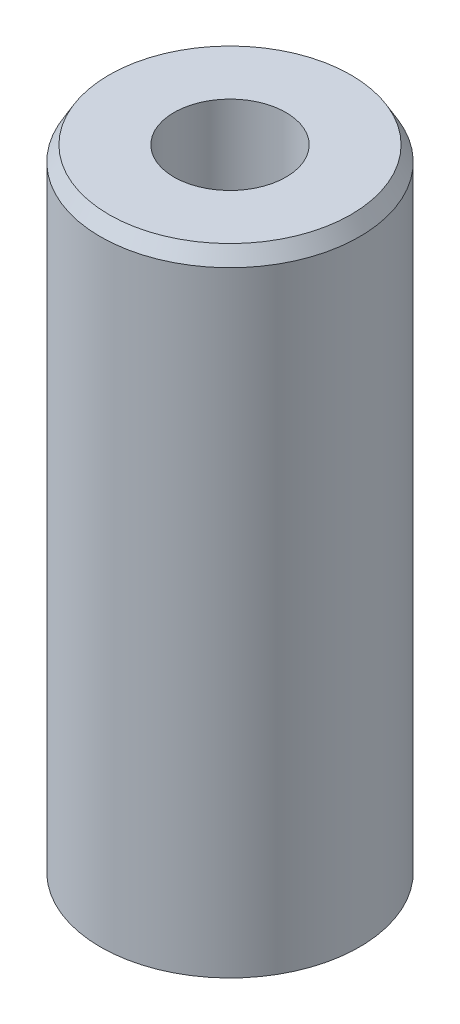
from build123d import *
from OCP.BRepFilletAPI import BRepFilletAPI_MakeChamfer

# Parameters (mm, degrees)
SKETCH1_R           = 17.5
BOSS_EXTRUDE1_DEPTH = 86.243804703
SKETCH2_R           = 7.564750867
CUT_EXTRUDE1_DEPTH  = 90.724544299
CHAMFER1_SIZE       = 2.008212914
CHAMFER1_SIZE2      = 1.159442267


with BuildPart() as part:
    # Sketch1 → Boss-Extrude1 (new body)
    with BuildSketch(Plane(origin=(0, 0, 0), x_dir=(1, 0, 0), z_dir=(0, 1, 0))):
        Circle(SKETCH1_R)
    extrude(amount=BOSS_EXTRUDE1_DEPTH)

    # Sketch2 → Cut-Extrude1 (cut, through all)
    with BuildSketch(Plane(origin=(0, 0, 0), x_dir=(1, 0, 0), z_dir=(0, 1, 0))):
        Circle(SKETCH2_R)
    extrude(amount=CUT_EXTRUDE1_DEPTH, mode=Mode.SUBTRACT)

    # Chamfer1: one chamfer whose edges measure the first distance from different faces: ONE call of the kernel's chamfer builder (chamfer() names one face for all edges)
    chamfer1_edges_1 = [part.edges().sort_by_distance(p)[0] for p in [
        (-17.5, 86.243804703, 0),
    ]]
    chamfer1_side_1 = [part.faces().sort_by_distance(p)[0] for p in [
        (-17.5, 43.121902352, 0),
    ]]
    chamfer1_edges_2 = [part.edges().sort_by_distance(p)[0] for p in [
        (-17.5, 0, 0),
    ]]
    chamfer1_side_2 = [part.faces().sort_by_distance(p)[0] for p in [
        (-17.005025253, 0, 0),
    ]]
    chamfer1 = BRepFilletAPI_MakeChamfer(part.part.solid().wrapped)
    for e in chamfer1_edges_1:
        chamfer1.Add(CHAMFER1_SIZE, CHAMFER1_SIZE2, e.wrapped, chamfer1_side_1[0].wrapped)  # the first distance lies on this face
    for e in chamfer1_edges_2:
        chamfer1.Add(CHAMFER1_SIZE, CHAMFER1_SIZE2, e.wrapped, chamfer1_side_2[0].wrapped)  # the first distance lies on this face
    add(Compound.cast(chamfer1.Shape()), mode=Mode.REPLACE)


solid = part.part
